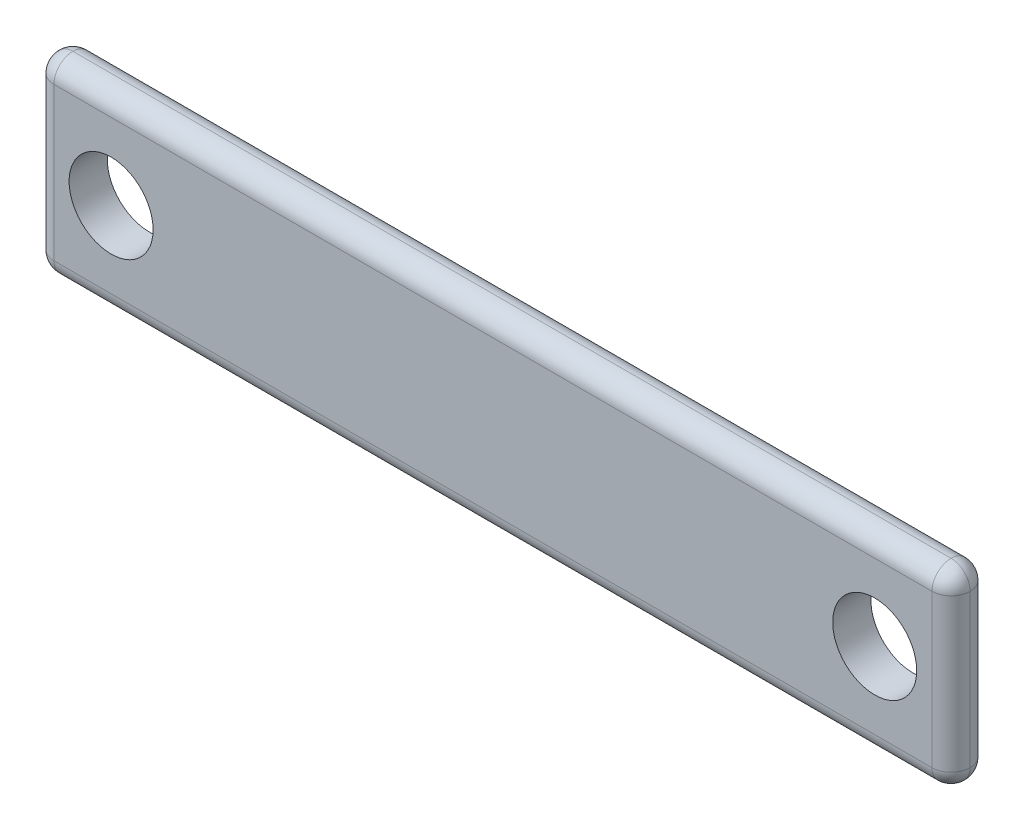
from build123d import *

# Parameters (mm, degrees)
ESBO_O1_W                = 240
ESBO_O1_H                = 50
ESBO_O1_R                = 11
RESSALTO_EXTRUS_O1_DEPTH = 10
FILETE1_R                = 5


with BuildPart() as part:
    # Esboço1 → Ressalto-extrusão1 (new body)
    with BuildSketch(Plane.XY):
        with Locations((120, 25)):
            Rectangle(ESBO_O1_W, ESBO_O1_H)
        with Locations((20, 25)):
            Circle(ESBO_O1_R, mode=Mode.SUBTRACT)
        with Locations((220, 25)):
            Circle(ESBO_O1_R, mode=Mode.SUBTRACT)
    extrude(amount=RESSALTO_EXTRUS_O1_DEPTH)

    # Filete1
    filete1_edges = [part.edges().sort_by_distance(p)[0] for p in [
        (120, 50, 10),
        (0, 25, 10),
        (120, 0, 10),
        (0, 25, 0),
        (120, 50, 0),
        (240, 25, 0),
        (120, 0, 0),
        (0, 0, 5),
        (0, 50, 5),
        (240, 50, 5),
        (240, 0, 5),
        (240, 25, 10),
    ]]
    fillet(filete1_edges, radius=FILETE1_R - 0.0001)  # a hair under: the kernel refuses the full size


solid = part.part
